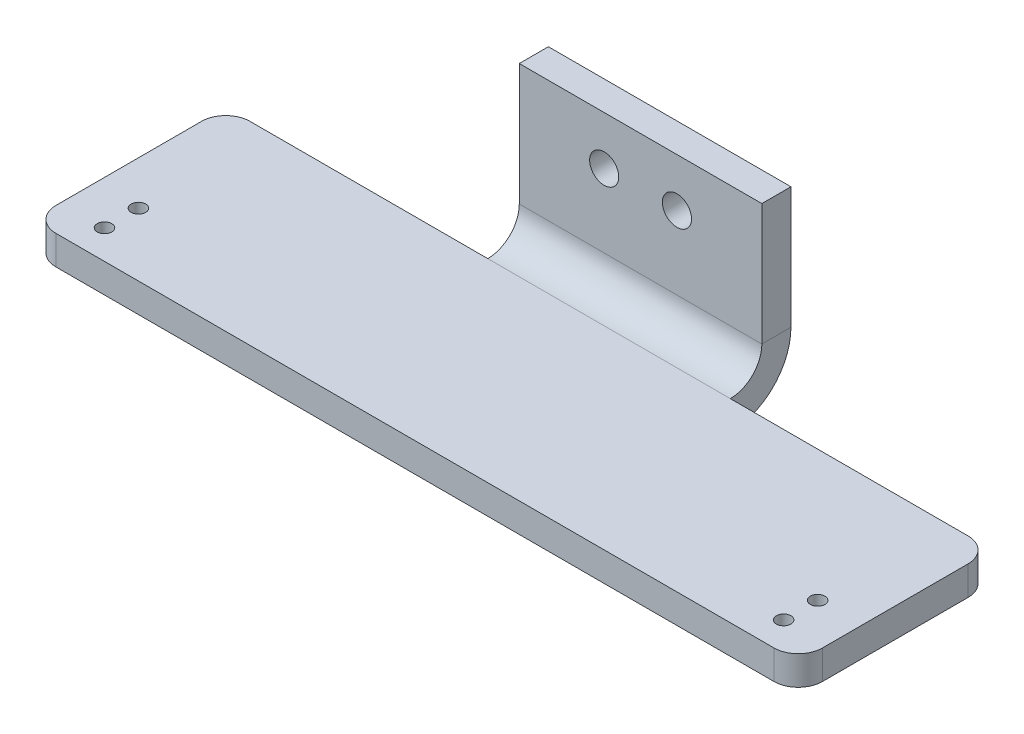
from build123d import *

# Parameters (mm, degrees)
BASE_FLANGE1_DEPTH     = 6
SKETCHED_START         = -25
SKETCHED_BEND1_DEPTH   = 50
SKETCHED_BEND1_2_DEPTH = 50
SKETCH7_R              = 1.5
CUT_EXTRUDE1_DEPTH     = 92.073510938
FILLET1_R              = 5
SKETCH8_R              = 3
CUT_EXTRUDE2_DEPTH     = 97.955579492


# Read off the part's stored shape, not the designer's step: Sketched Bend1
# Sheet-metal steps are written as plain solids
with BuildPart() as part:
    # Sketch1 → Base-Flange1 (new body)
    with BuildSketch(Plane(origin=(0, 0, 0), x_dir=(1, 0, 0), z_dir=(0, 1, 0))):
        Polygon((25, 20), (79, 20), (79, -20), (-79, -20), (-79, 20), (-25, 20), (-25, 60), (25, 60), align=None)
    extrude(amount=-BASE_FLANGE1_DEPTH)

    # Sketched Bend1 outline → Sketched Bend1 (cut)
    with BuildSketch(Plane.YZ.offset(SKETCHED_START)):
        with BuildLine():
            Line((0, -60), (0, -30.677078252))
            ThreePointArc((0, -30.677078252), (-4.397247359, -26.123724357), (-6, -20))
            Line((-6, -20), (-6, -60))
            Line((-6, -60), (0, -60))
        make_face()
    extrude(amount=SKETCHED_BEND1_DEPTH, mode=Mode.SUBTRACT)

    # Sketched Bend1 2 outline → Sketched Bend1 2 (add)
    with BuildSketch(Plane.YZ.offset(SKETCHED_START)):
        with BuildLine():
            Line((6.5, -32.5), (31.577434895, -32.5))
            Line((31.577434895, -32.5), (31.577434895, -26.5))
            Line((31.577434895, -26.5), (6.5, -26.5))
            ThreePointArc((6.5, -26.5), (1.903805922, -24.596194078), (0, -20))
            Line((0, -20), (0, -30.677078252))
            ThreePointArc((0, -30.677078252), (3.124609515, -32.035644523), (6.5, -32.5))
        make_face()
    extrude(amount=SKETCHED_BEND1_2_DEPTH)

    # Sketch7 → Cut-Extrude1 (cut, through all)
    with BuildSketch(Plane(origin=(0, 0, 0), x_dir=(1, 0, 0), z_dir=(0, 1, 0))):
        with Locations(Location((-70, -7, 0), (0, 0, 270))):
            Circle(SKETCH7_R)
        with Locations(Location((-70, -14, 0), (0, 0, 270))):
            Circle(SKETCH7_R)
        with Locations(Location((70, -14, 0), (0, 0, 90))):
            Circle(SKETCH7_R)
        with Locations(Location((70, -7, 0), (0, 0, 90))):
            Circle(SKETCH7_R)
    extrude(amount=-CUT_EXTRUDE1_DEPTH, mode=Mode.SUBTRACT)

    # Fillet1
    fillet1_edges = [part.edges().sort_by_distance(p)[0] for p in [
        (-79, -3, 20),
        (79, -3, 20),
        (79, -3, -20),
        (-79, -3, -20),
    ]]
    fillet(fillet1_edges, radius=FILLET1_R)

    # Sketch8 → Cut-Extrude2 (cut, through all)
    with BuildSketch(Plane.XY.offset(-26.5)):
        with Locations((-7.5, 21.577434895)):
            Circle(SKETCH8_R)
        with Locations(Location((7.5, 21.577434895, 0), (0, 0, 180))):
            Circle(SKETCH8_R)
    extrude(amount=-CUT_EXTRUDE2_DEPTH, mode=Mode.SUBTRACT)


solid = part.part
